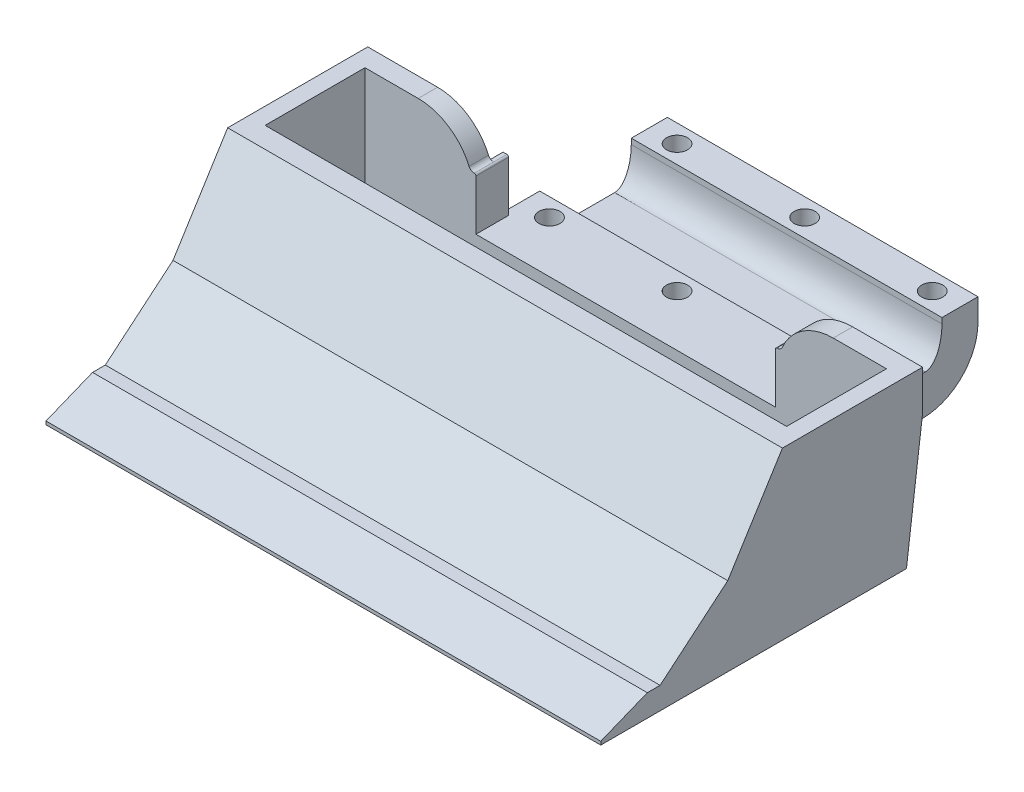
from build123d import *

# Parameters (mm, degrees)
RESSALTO_EXTRUS_O1_DEPTH = 30
CORTE_EXTRUS_O1_DEPTH    = 100
ESBO_O4_W                = 94
ESBO_O4_H                = 25
CORTE_EXTRUS_O2_DEPTH    = 10
ESBO_O5_W                = 94
ESBO_O5_H                = 18
CORTE_EXTRUS_O3_DEPTH    = 20
CORTE_EXTRUS_O7_START    = -3
CORTE_EXTRUS_O7_DEPTH    = 94
ESBO_O8_W                = 32
ESBO_O8_H                = 15
CORTE_EXTRUS_O8_DEPTH    = 56
ESBO_O9_W                = 16.5
ESBO_O9_H                = 8
CORTE_EXTRUS_O9_DEPTH    = 56
FILETE1_SIZE             = 3
FILETE1_SIZE_2           = 6
FILETE2_SIZE             = 3
FILETE2_SIZE_2           = 6
FILETE3_R                = 10
ESBO_O12_W               = 32
ESBO_O12_H               = 1
CORTE_EXTRUS_O12_DEPTH   = 68
CORTE_EXTRUS_O13_REACH   = 121.432
ESBO_O14_W               = 56
ESBO_O14_H               = 16
CORTE_EXTRUS_O14_DEPTH   = 138.840487586
ESBO_O16_R               = 1.9
CORTE_EXTRUS_O15_DEPTH   = 136.484316502
ESBO_O19_W               = 5.89
ESBO_O19_H               = 9.379485794
RESSALTO_EXTRUS_O4_DEPTH = 1
ESBO_O20_W               = 5.89
ESBO_O20_H               = 9.379485794
RESSALTO_EXTRUS_O5_DEPTH = 1
FILETE5_R                = 10
FILETE6_R                = 0.3
FILETE7_R                = 1
CORTE_EXTRUS_O17_DEPTH   = 22
CORTE_EXTRUS_O18_DEPTH   = 22
CORTE_EXTRUS_O19_DEPTH   = 124


with BuildPart() as part:
    # Esboço2 → Ressalto-extrusão1 (new body)
    with BuildSketch(Plane(origin=(0, 0, 0), x_dir=(1, 0, 0), z_dir=(0, 1, 0))):
        Polygon((0, 0), (0, 58), (22, 58), (22, 90), (78, 90), (78, 58), (100, 58), (100, 0), align=None)
    extrude(amount=RESSALTO_EXTRUS_O1_DEPTH)

    # Esboço3 → Corte-extrusão1 (cut)
    with BuildSketch(Plane(origin=(100, 0, 0), x_dir=(0, 0, -1), z_dir=(1, 0, 0))):
        Polygon((0, 0.6), (9.828405069, 4.570933406), (22.126818959, 14.890527965), (31.568264957, 30), (0, 30), align=None)
    extrude(amount=-CORTE_EXTRUS_O1_DEPTH, mode=Mode.SUBTRACT)

    # Esboço4 → Corte-extrusão2 (cut)
    with BuildSketch(Plane.XZ):
        with Locations((50, -40.5)):
            Rectangle(ESBO_O4_W, ESBO_O4_H)
    extrude(amount=-CORTE_EXTRUS_O2_DEPTH, mode=Mode.SUBTRACT)

    # Esboço5 → Corte-extrusão3 (cut)
    with BuildSketch(Plane(origin=(0, 30, 0), x_dir=(1, 0, 0), z_dir=(0, 1, 0))):
        with Locations((50, 45.5)):
            Rectangle(ESBO_O5_W, ESBO_O5_H)
    extrude(amount=-CORTE_EXTRUS_O3_DEPTH, mode=Mode.SUBTRACT)

    # Esboço7 → Corte-extrusão7 (cut)
    with BuildSketch(Plane(origin=(100, 0, 0), x_dir=(0, 0, -1), z_dir=(1, 0, 0)).offset(CORTE_EXTRUS_O7_START)):
        Polygon((28, 10), (36.5, 30), (36.5, 10), align=None)
    extrude(amount=-CORTE_EXTRUS_O7_DEPTH, mode=Mode.SUBTRACT)

    # Esboço8 → Corte-extrusão8 (cut)
    with BuildSketch(Plane(origin=(78, 0, 0), x_dir=(0, 0, -1), z_dir=(1, 0, 0))):
        with Locations((74, 22.5)):
            Rectangle(ESBO_O8_W, ESBO_O8_H)
    extrude(amount=-CORTE_EXTRUS_O8_DEPTH, mode=Mode.SUBTRACT)

    # Esboço9 → Corte-extrusão9 (cut)
    with BuildSketch(Plane(origin=(78, 0, 0), x_dir=(0, 0, -1), z_dir=(1, 0, 0))):
        with Locations((75.25, 11)):
            Rectangle(ESBO_O9_W, ESBO_O9_H)
    extrude(amount=-CORTE_EXTRUS_O9_DEPTH, mode=Mode.SUBTRACT)

    # Filete1
    # an asymmetric fillet: 6, 3 mm, written as the material it adds along each edge
    with BuildSketch(Plane(origin=(78, 7, -67), x_dir=(0, 0, -1), z_dir=(-1, 0, 0))) as filete1_piece_1:
        with BuildLine():
            Bezier((FILETE1_SIZE, 0), (0, 0), (0, -FILETE1_SIZE_2), weights=[1, 0.707106781, 1])
            Line((0, -FILETE1_SIZE_2), (0, 0))
            Line((0, 0), (FILETE1_SIZE, 0))
        make_face()
    extrude(amount=56)

    # Filete2
    # an asymmetric fillet: 6, 3 mm, written as the material it adds along each edge
    with BuildSketch(Plane(origin=(78, 7, -83.5), x_dir=(0, 0, 1), z_dir=(-1, 0, 0))) as filete2_piece_1:
        with BuildLine():
            Bezier((FILETE2_SIZE, 0), (0, 0), (0, FILETE2_SIZE_2), weights=[1, 0.707106781, 1])
            Line((0, FILETE2_SIZE_2), (0, 0))
            Line((0, 0), (FILETE2_SIZE, 0))
        make_face()
    extrude(amount=56)

    # Filete3
    filete3_edges = [part.edges().sort_by_distance(p)[0] for p in [
        (50, 0, -90),
    ]]
    fillet(filete3_edges, radius=FILETE3_R)

    # Esboço12 → Corte-extrusão12 (cut)
    with BuildSketch(Plane.ZY.offset(-22)):
        with Locations((-74, 14.5)):
            Rectangle(ESBO_O12_W, ESBO_O12_H)
    extrude(amount=-CORTE_EXTRUS_O12_DEPTH, mode=Mode.SUBTRACT)

    # Esboço14 → Corte-extrusão13 (cut, up to next)
    with BuildSketch(Plane(origin=(0, 0, -58), x_dir=(-1, 0, 0), z_dir=(0, 0, -1)), mode=Mode.PRIVATE) as corte_extrus_o13_sk1:
        with Locations((-50, 22)):
            Rectangle(ESBO_O14_W, ESBO_O14_H)
    corte_extrus_o13_tool1 = extrude(corte_extrus_o13_sk1.sketch, amount=-CORTE_EXTRUS_O13_REACH, mode=Mode.PRIVATE) & part.part
    add(corte_extrus_o13_tool1.solids().sort_by_distance((50, 22, -58))[0], mode=Mode.SUBTRACT)

    # Esboço15 → Corte-extrusão14 (cut, through all)
    with BuildSketch(Plane(origin=(100, 0, 0), x_dir=(0, 0, -1), z_dir=(1, 0, 0))):
        Polygon((9.048997211, 4.256032191), (10.048997211, 4.256032191), (10.048997211, 4.756032191), align=None)
    extrude(amount=-CORTE_EXTRUS_O14_DEPTH, mode=Mode.SUBTRACT)

    # Esboço16 → Corte-extrusão15 (cut, through all)
    with BuildSketch(Plane(origin=(0, 14, 0), x_dir=(1, 0, 0), z_dir=(0, 1, 0))):
        with Locations(Location((73, 86.75, 0), (0, 0, 270))):
            Circle(ESBO_O16_R)
        with Locations(Location((27, 86.75, 0), (0, 0, 270))):
            Circle(ESBO_O16_R)
        with Locations(Location((73, 63.75, 0), (0, 0, 90))):
            Circle(ESBO_O16_R)
        with Locations(Location((27, 63.75, 0), (0, 0, 90))):
            Circle(ESBO_O16_R)
        with Locations(Location((50, 86.75, 0), (0, 0, 270))):
            Circle(ESBO_O16_R)
        with Locations(Location((50, 63.75, 0), (0, 0, 90))):
            Circle(ESBO_O16_R)
    extrude(amount=-CORTE_EXTRUS_O15_DEPTH, mode=Mode.SUBTRACT)

    # Esboço19 → Ressalto-extrusão4 (add)
    with BuildSketch(Plane.ZY.offset(-78)):
        with Locations((-57.445, 18.689742897)):
            Rectangle(ESBO_O19_W, ESBO_O19_H)
    extrude(amount=RESSALTO_EXTRUS_O4_DEPTH)

    # Esboço20 → Ressalto-extrusão5 (add)
    with BuildSketch(Plane(origin=(22, 0, 0), x_dir=(0, 0, -1), z_dir=(1, 0, 0))):
        with Locations((57.445, 18.689742897)):
            Rectangle(ESBO_O20_W, ESBO_O20_H)
    extrude(amount=RESSALTO_EXTRUS_O5_DEPTH)

    # Filete5
    # the kernel refuses this fillet: 10 mm, written as the material it takes off along each edge
    with BuildSketch(Plane(origin=(22, 30, -81.529114381), x_dir=(0, -1, 0), z_dir=(0, 0, 1))) as filete5_piece_1_section:
        with BuildLine():
            CenterArc((10, -9.411645752), FILETE5_R, 109.75193963, 70.24806037)
            Line((0, -9.411645752), (0, 0))
            Line((0, 0), (6.620514206, 0))
        make_face()
    filete5_piece_1 = extrude(amount=50.558228762, mode=Mode.PRIVATE)
    filete5_piece_1 = split(filete5_piece_1, bisect_by=Plane(origin=(18.353344597, 35.581105786, -38.871969959), z_dir=(0, -0.39114064034485163, -0.9203309184584747)), keep=Keep.TOP, mode=Mode.PRIVATE)
    add(filete5_piece_1, mode=Mode.SUBTRACT)
    with BuildSketch(Plane(origin=(78, 30, -81.529114381), x_dir=(0, -1, 0), z_dir=(0, 0, 1))) as filete5_piece_2_section:
        with BuildLine():
            CenterArc((10, 9.411645752), FILETE5_R, 180, 70.24806037)
            Line((0, 9.411645752), (0, 0))
            Line((0, 0), (6.620514206, 0))
        make_face()
    filete5_piece_2 = extrude(amount=50.558228762, mode=Mode.PRIVATE)
    filete5_piece_2 = split(filete5_piece_2, bisect_by=Plane(origin=(81.646655403, 35.581105786, -38.871969959), z_dir=(0, -0.39114064034485163, -0.9203309184584747)), keep=Keep.TOP, mode=Mode.PRIVATE)
    add(filete5_piece_2, mode=Mode.SUBTRACT)

    # Filete6
    filete6_edges = [part.edges().sort_by_distance(p)[0] for p in [
        (77, 23.379485794, -57.445),
        (23, 23.379485794, -57.445),
    ]]
    fillet(filete6_edges, radius=FILETE6_R)

    # Filete7
    filete7_edges = [part.edges().sort_by_distance(p)[0] for p in [
        (78, 23.379485794, -56.25),
        (22, 23.379485794, -56.25),
    ]]
    fillet(filete7_edges, radius=FILETE7_R)

    # Esboço22 → Corte-extrusão17 (cut)
    with BuildSketch(Plane.ZY):
        Polygon((-58, 0), (-58, 22.70530007), (-55.105367164, 0), align=None)
    extrude(amount=-CORTE_EXTRUS_O17_DEPTH, mode=Mode.SUBTRACT)

    # Esboço23 → Corte-extrusão18 (cut)
    with BuildSketch(Plane(origin=(100, 0, 0), x_dir=(0, 0, -1), z_dir=(1, 0, 0))):
        Polygon((58, 0), (55.102867158, 0), (58, 22.71), align=None)
    extrude(amount=-CORTE_EXTRUS_O18_DEPTH, mode=Mode.SUBTRACT)

    # Esboço27 → Corte-extrusão19 (cut)
    with BuildSketch(Plane.ZY):
        Polygon((-31.568264957, 30), (-22.126818959, 14.890527965), (-10.048997211, 4.756032191), (-7.995032748, 3.989987748), (-10.691784821, 3.989987748), (-22.89093609, 14.226291078), (-32.747443361, 30), align=None)
    extrude(amount=-CORTE_EXTRUS_O19_DEPTH, mode=Mode.SUBTRACT)


solid = part.part
